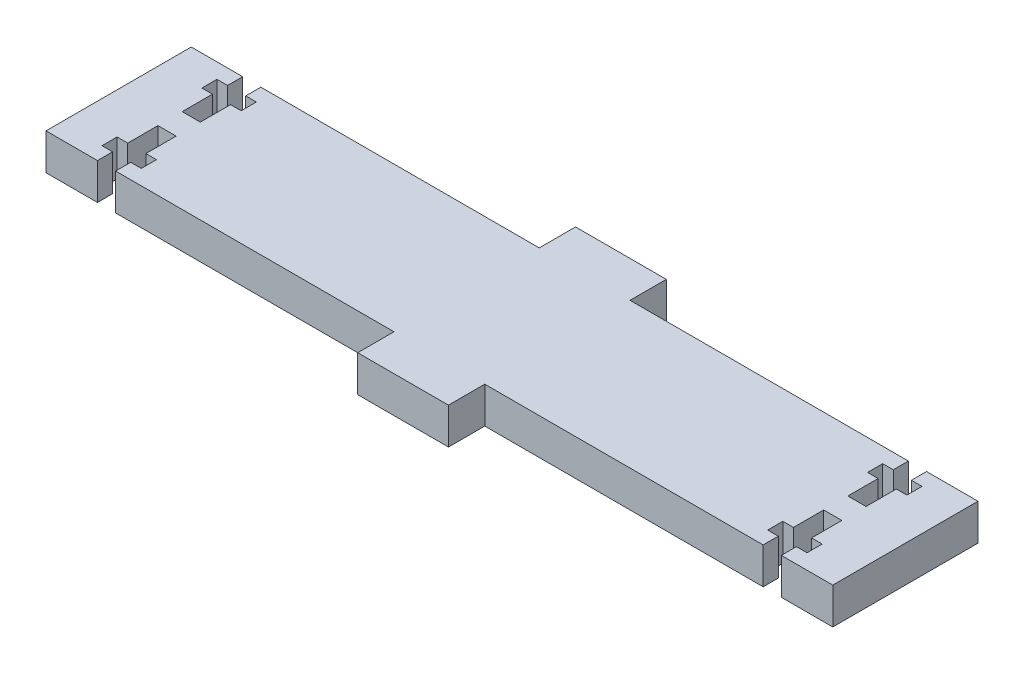
from build123d import *

# Parameters (mm, degrees)
BOSS_EXTRUDE1_DEPTH = 6


with BuildPart() as part:
    # Sketch1 → Boss-Extrude1 (new body)
    with BuildSketch(Plane(origin=(0, 0, 0), x_dir=(1, 0, 0), z_dir=(0, 1, 0))):
        Polygon((-56.5, 12), (-65, 12), (-65, -12), (-56.5, -12), (-56.5, -9.5), (-58.25, -9.5), (-58.25, -7), (-56.5, -7), (-56.5, -2), (-53.5, -2), (-53.5, -7), (-51.75, -7), (-51.75, -9.5), (-53.5, -9.5), (-53.5, -12), (-7.5, -12), (-7.5, -18), (7.5, -18), (7.5, -12), (53.5, -12), (53.5, -9.5), (51.75, -9.5), (51.75, -7), (53.5, -7), (53.5, -2), (56.5, -2), (56.5, -7), (58.25, -7), (58.25, -9.5), (56.5, -9.5), (56.5, -12), (65, -12), (65, 12), (56.5, 12), (56.5, 9.5), (58.25, 9.5), (58.25, 7), (56.5, 7), (56.5, 2), (53.5, 2), (53.5, 7), (51.75, 7), (51.75, 9.5), (53.5, 9.5), (53.5, 12), (7.5, 12), (7.5, 18), (-7.5, 18), (-7.5, 12), (-53.5, 12), (-53.5, 9.5), (-51.75, 9.5), (-51.75, 7), (-53.5, 7), (-53.5, 2), (-56.5, 2), (-56.5, 7), (-58.25, 7), (-58.25, 9.5), (-56.5, 9.5), align=None)
    extrude(amount=BOSS_EXTRUDE1_DEPTH)


solid = part.part
